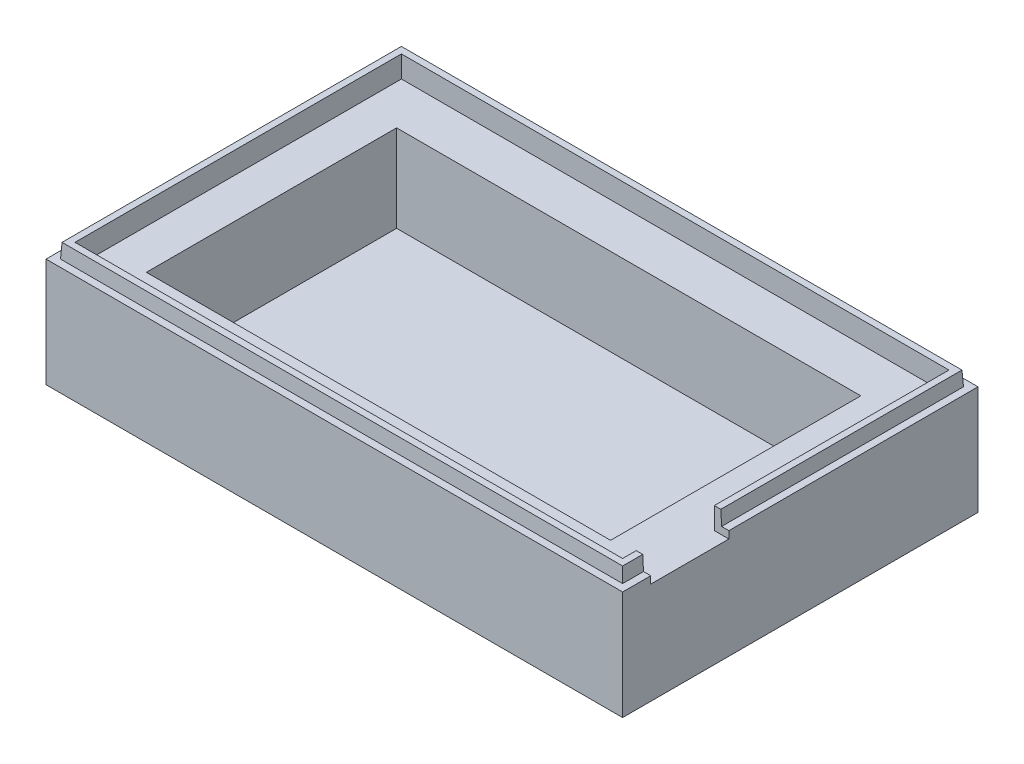
from build123d import *

# Parameters (mm, degrees)
SKETCH1_W           = 79.5
SKETCH1_H           = 49
BOSS_EXTRUDE1_DEPTH = 15
SKETCH2_W           = 64
SKETCH2_H           = 34.5
CUT_EXTRUDE1_DEPTH  = 13
SKETCH3_W           = 75.5
SKETCH3_H           = 45
CUT_EXTRUDE2_DEPTH  = 1
CUT_EXTRUDE3_REACH  = 96.585
SKETCH5_W           = 10.77
SKETCH5_H           = 1
LIP1_START          = -48
LIP1_DEPTH          = 1
LIP1_START_2        = -2
LIP1_2_DEPTH        = 1
LIP1_START_3        = -47
LIP1_3_DEPTH        = 32.35
LIP1_START_4        = -14.65
LIP1_4_DEPTH        = 12.65
LIP1_START_5        = -3.88
LIP1_5_DEPTH        = 1.88
LIP1_6_DEPTH        = 79


with BuildPart() as part:
    # Sketch1 → Boss-Extrude1 (new body)
    with BuildSketch(Plane(origin=(0, 0, 0), x_dir=(1, 0, 0), z_dir=(0, 1, 0))):
        with Locations((39.75, 24.5)):
            Rectangle(SKETCH1_W, SKETCH1_H)
    extrude(amount=BOSS_EXTRUDE1_DEPTH)

    # Sketch2 → Cut-Extrude1 (cut)
    with BuildSketch(Plane(origin=(0, 15, 0), x_dir=(1, 0, 0), z_dir=(0, 1, 0))):
        with Locations((39.5, 23.59)):
            Rectangle(SKETCH2_W, SKETCH2_H)
    extrude(amount=-CUT_EXTRUDE1_DEPTH, mode=Mode.SUBTRACT)

    # Sketch3 → Cut-Extrude2 (cut)
    with BuildSketch(Plane(origin=(0, 15, 0), x_dir=(1, 0, 0), z_dir=(0, 1, 0))):
        with Locations((39.75, 24.5)):
            Rectangle(SKETCH3_W, SKETCH3_H)
    extrude(amount=-CUT_EXTRUDE2_DEPTH, mode=Mode.SUBTRACT)

    # Sketch5 → Cut-Extrude3 (cut, up to next)
    with BuildSketch(Plane(origin=(79.5, 0, 0), x_dir=(0, 0, -1), z_dir=(1, 0, 0)), mode=Mode.PRIVATE) as cut_extrude3_sk1:
        with Locations((9.265, 14.5)):
            Rectangle(SKETCH5_W, SKETCH5_H)
    cut_extrude3_tool1 = extrude(cut_extrude3_sk1.sketch, amount=-CUT_EXTRUDE3_REACH, mode=Mode.PRIVATE) & part.part
    add(cut_extrude3_tool1.solids().sort_by_distance((79.5, 14.5, -9.265))[0], mode=Mode.SUBTRACT)

    # Lip1: read off the stored shape, not the designer's step
    # Lip1 outline → Lip1 (add)
    with BuildSketch(Plane.XY.offset(LIP1_START)):
        Polygon((78.5, 15), (78.395184441, 17), (1.104815559, 17), (1, 15), align=None)
    extrude(amount=LIP1_DEPTH)

    # Lip1 2 outline → Lip1 2 (add)
    with BuildSketch(Plane.XY.offset(LIP1_START_2)):
        Polygon((78.5, 15), (78.395184441, 17), (1.104815559, 17), (1, 15), align=None)
    extrude(amount=LIP1_2_DEPTH)

    # Lip1 3 outline → Lip1 3 (add)
    with BuildSketch(Plane.XY.offset(LIP1_START_3)):
        Polygon((77.5, 17), (77.5, 15), (78.5, 15), (78.395184441, 17), align=None)
        Polygon((1, 15), (2, 15), (2, 17), (1.104815559, 17), align=None)
    extrude(amount=LIP1_3_DEPTH)

    # Lip1 4 outline → Lip1 4 (add)
    with BuildSketch(Plane.XY.offset(LIP1_START_4)):
        Polygon((1, 15), (2, 15), (2, 17), (1.104815559, 17), align=None)
    extrude(amount=LIP1_4_DEPTH)

    # Lip1 5 outline → Lip1 5 (add)
    with BuildSketch(Plane.XY.offset(LIP1_START_5)):
        Polygon((77.5, 17), (77.5, 15), (78.5, 15), (78.395184441, 17), align=None)
    extrude(amount=LIP1_5_DEPTH)

    # Lip1 6 outline → Lip1 6 (cut)
    with BuildSketch(Plane.YZ):
        Polygon((17, -48), (17, -47.895184441), (15, -48), align=None)
        Polygon((15, -1), (17, -1.104815559), (17, -1), align=None)
    extrude(amount=LIP1_6_DEPTH, mode=Mode.SUBTRACT)


solid = part.part
